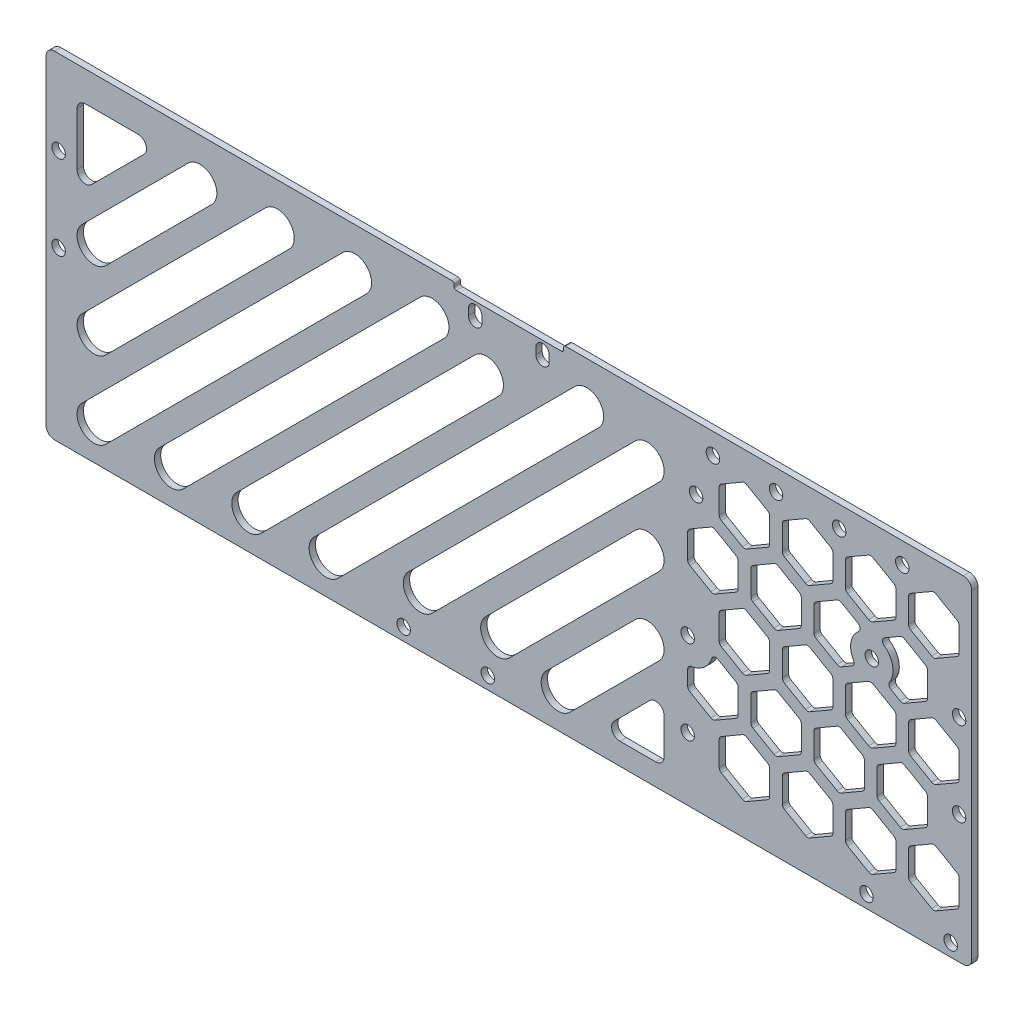
from build123d import *

# Parameters (mm, degrees)
SKETCH_1_W          = 220
SKETCH_1_H          = 80
EXTRUDE_1_DEPTH     = 1.5
SKETCH_2_R          = 1.6
CUT_EXTRUDE_1_DEPTH = 10
SKETCH_3_W          = 26
SKETCH_3_H          = 3
CUT_EXTRUDE_2_DEPTH = 11.5
FILLET_1_R          = 0.5
CUT_EXTRUDE_3_DEPTH = 2
FILLET_2_R          = 2
CUT_EXTRUDE_4_DEPTH = 10
OTHER_1_DEPTH       = 1.5
SKETCH_7_R          = 5.042374288
SKETCH_7_R_2        = 1.6
SKETCH_7_R_3        = 6.035452472
EXTRUDE_2_DEPTH     = 1.5
FILLET_4_R          = 1
SKETCH_8_R          = 1.6
CUT_EXTRUDE_5_DEPTH = 1.5
FILLET_5_R          = 2


# Read off the part's stored shape, not the designer's step: 填充阵列1
with BuildPart() as part:
    # 草图1 → 凸台-拉伸1 (new body)
    with BuildSketch(Plane.XY):
        Rectangle(SKETCH_1_W, SKETCH_1_H)
    extrude(amount=EXTRUDE_1_DEPTH)

    # 草图2 → 切除-拉伸1 (cut)
    with BuildSketch(Plane(origin=(0, 0, 0), x_dir=(-1, 0, 0), z_dir=(0, 0, -1))):
        with Locations((-105, -37)):
            Circle(SKETCH_2_R)
        with Locations((-85, -37)):
            Circle(SKETCH_2_R)
        with Locations((25, -37)):
            Circle(SKETCH_2_R)
        with Locations((5, -37)):
            Circle(SKETCH_2_R)
        with Locations((-42.5, -5)):
            Circle(SKETCH_2_R)
        with Locations((-42.5, -25)):
            Circle(SKETCH_2_R)
        with Locations((-86.258808939, 12.137759751)):
            Circle(SKETCH_2_R)
        with Locations((107, 20)):
            Circle(SKETCH_2_R)
        with Locations((107, 0)):
            Circle(SKETCH_2_R)
    extrude(amount=-CUT_EXTRUDE_1_DEPTH, mode=Mode.SUBTRACT)

    # 草图3 → 切除-拉伸2 (cut)
    with BuildSketch(Plane(origin=(0, 0, 0), x_dir=(-1, 0, 0), z_dir=(0, 0, -1))):
        with Locations((0, 40)):
            Rectangle(SKETCH_3_W, SKETCH_3_H)
        with BuildLine():
            Line((-6.4, 36.25), (-6.4, 34.75))
            ThreePointArc((-6.4, 34.75), (-8, 33.15), (-9.6, 34.75))
            Line((-9.6, 34.75), (-9.6, 36.25))
            ThreePointArc((-9.6, 36.25), (-8, 37.85), (-6.4, 36.25))
        make_face()
        with BuildLine():
            Line((6.4, 36.25), (6.4, 34.75))
            ThreePointArc((6.4, 34.75), (8, 33.15), (9.6, 34.75))
            Line((9.6, 34.75), (9.6, 36.25))
            ThreePointArc((9.6, 36.25), (8, 37.85), (6.4, 36.25))
        make_face()
    extrude(amount=-CUT_EXTRUDE_2_DEPTH, mode=Mode.SUBTRACT)

    # 圆角1
    fillet_1_edges = [part.edges().sort_by_distance(p)[0] for p in [
        (-13, 40, 0.75),
        (13, 40, 0.75),
        (13, 38.5, 0.75),
        (-13, 38.5, 0.75),
    ]]
    fillet(fillet_1_edges, radius=FILLET_1_R)

    # 草图5 → 切除-拉伸3 (cut)
    with BuildSketch(Plane(origin=(0, 0, 0), x_dir=(-1, 0, 0), z_dir=(0, 0, -1))):
        with BuildLine():
            Line((-30.071572875, -7.95836944), (-8.85836944, -29.171572875))
            ThreePointArc((-8.85836944, -29.171572875), (-8.85836944, -34.828427125), (-14.515223689, -34.828427125))
            Line((-14.515223689, -34.828427125), (-35.728427125, -13.615223689))
            ThreePointArc((-35.728427125, -13.615223689), (-35.728427125, -7.95836944), (-30.071572875, -7.95836944))
        make_face()
        with BuildLine():
            Line((-30.071572875, 10.426406871), (5.526406871, -25.171572875))
            ThreePointArc((5.526406871, -25.171572875), (5.526406871, -30.828427125), (-0.130447378, -30.828427125))
            Line((-0.130447378, -30.828427125), (-35.728427125, 4.769552622))
            ThreePointArc((-35.728427125, 4.769552622), (-35.728427125, 10.426406871), (-30.071572875, 10.426406871))
        make_face()
        with BuildLine():
            Line((-15.704040507, 32.828427125), (46.295959493, -29.171572875))
            ThreePointArc((46.295959493, -29.171572875), (46.295959493, -34.828427125), (40.639105243, -34.828427125))
            Line((40.639105243, -34.828427125), (-21.360894757, 27.171572875))
            ThreePointArc((-21.360894757, 27.171572875), (-21.360894757, 32.828427125), (-15.704040507, 32.828427125))
        make_face()
        with BuildLine():
            Line((8.112193309, 27.39696962), (64.680735804, -29.171572875))
            ThreePointArc((64.680735804, -29.171572875), (64.680735804, -34.828427125), (59.023881554, -34.828427125))
            Line((59.023881554, -34.828427125), (2.455339059, 21.74011537))
            ThreePointArc((2.455339059, 21.74011537), (2.455339059, 27.39696962), (8.112193309, 27.39696962))
        make_face()
        with BuildLine():
            Line((39.450288425, 32.828427125), (101.450288425, -29.171572875))
            ThreePointArc((101.450288425, -29.171572875), (101.450288425, -34.828427125), (95.793434176, -34.828427125))
            Line((95.793434176, -34.828427125), (33.793434176, 27.171572875))
            ThreePointArc((33.793434176, 27.171572875), (33.793434176, 32.828427125), (39.450288425, 32.828427125))
        make_face()
        with BuildLine():
            Line((76.219841047, 32.828427125), (101.450288425, 7.597979746))
            ThreePointArc((101.450288425, 7.597979746), (101.450288425, 1.941125497), (95.793434176, 1.941125497))
            Line((95.793434176, 1.941125497), (70.562986798, 27.171572875))
            ThreePointArc((70.562986798, 27.171572875), (70.562986798, 32.828427125), (76.219841047, 32.828427125))
        make_face()
        with BuildLine():
            Line((21.065512115, 32.828427125), (83.065512115, -29.171572875))
            ThreePointArc((83.065512115, -29.171572875), (83.065512115, -34.828427125), (77.408657865, -34.828427125))
            Line((77.408657865, -34.828427125), (15.408657865, 27.171572875))
            ThreePointArc((15.408657865, 27.171572875), (15.408657865, 32.828427125), (21.065512115, 32.828427125))
        make_face()
        with BuildLine():
            Line((-30.071572875, 28.811183182), (23.911183182, -25.171572875))
            ThreePointArc((23.911183182, -25.171572875), (23.911183182, -30.828427125), (18.254328933, -30.828427125))
            Line((18.254328933, -30.828427125), (-35.728427125, 23.154328933))
            ThreePointArc((-35.728427125, 23.154328933), (-35.728427125, 28.811183182), (-30.071572875, 28.811183182))
        make_face()
        with BuildLine():
            Line((57.835064736, 32.828427125), (101.450288425, -10.786796564))
            ThreePointArc((101.450288425, -10.786796564), (101.450288425, -16.443650814), (95.793434176, -16.443650814))
            Line((95.793434176, -16.443650814), (52.178210487, 27.171572875))
            ThreePointArc((52.178210487, 27.171572875), (52.178210487, 32.828427125), (57.835064736, 32.828427125))
        make_face()
        Polygon((83.290908859, 32.828427125), (102.621861301, 32.828427125), (102.621861301, 13.497474683), align=None)
        Polygon((-36.9, -19.514718626), (-36.9, -34.828427125), (-21.586291501, -34.828427125), align=None)
    extrude(amount=-CUT_EXTRUDE_3_DEPTH, mode=Mode.SUBTRACT)

    # 圆角2
    fillet_2_edges = [part.edges().sort_by_distance(p)[0] for p in [
        (-102.621861301, 13.497474683, 0.75),
        (-83.290908859, 32.828427125, 0.75),
        (-102.621861301, 32.828427125, 0.75),
        (36.9, -19.514718626, 0.75),
        (21.586291501, -34.828427125, 0.75),
        (36.9, -34.828427125, 0.75),
    ]]
    fillet(fillet_2_edges, radius=FILLET_2_R)

    # 草图6 → 切除-拉伸4 (cut)
    with BuildSketch(Plane(origin=(0, 0, 0), x_dir=(-1, 0, 0), z_dir=(0, 0, -1))):
        Polygon((-107, -22.107695155), (-107, -29.035898385), (-101, -32.5), (-95, -29.035898385), (-95, -22.107695155), (-101, -18.643593539), align=None)
    extrude(amount=-CUT_EXTRUDE_4_DEPTH, mode=Mode.SUBTRACT)

    # 填充阵列1 outline → 填充阵列1 (cut)
    with BuildSketch(Plane.XY):
        Polygon((101, 19.461524227), (107, 22.925625842), (107, 29.853829072), (101, 33.317930688), (95, 29.853829072), (95, 22.925625842), align=None)
        Polygon((101, -6.519237886), (107, -3.055136271), (107, 3.873066959), (101, 7.337168574), (95, 3.873066959), (95, -3.055136271), align=None)
        Polygon((62, -3.055136271), (62, 3.873066959), (56, 7.337168574), (50, 3.873066959), (50, -3.055136271), (56, -6.519237886), align=None)
        Polygon((84.5, -16.045517328), (84.5, -9.117314098), (78.5, -5.653212483), (72.5, -9.117314098), (72.5, -16.045517328), (78.5, -19.509618943), align=None)
        with BuildLine():
            Line((93.5, 20.327549631), (87.5, 16.863448016))
            Line((87.5, 16.863448016), (87.5, 13.147435318))
            ThreePointArc((87.5, 13.147435318), (87.858808939, 12.137759751), (87.499999999, 11.128084183))
            Line((87.499999999, 11.128084183), (87.5, 9.935244785))
            Line((87.5, 9.935244785), (93.5, 6.47114317))
            Line((93.5, 6.47114317), (99.5, 9.935244785))
            Line((99.5, 9.935244785), (99.5, 16.863448016))
            Line((99.5, 16.863448016), (93.5, 20.327549631))
        make_face()
        Polygon((93.5, -5.653212483), (87.5, -9.117314098), (87.5, -16.045517328), (93.5, -19.509618943), (99.5, -16.045517328), (99.5, -9.117314098), align=None)
        Polygon((77, 22.925625842), (77, 29.853829072), (71, 33.317930688), (65, 29.853829072), (65, 22.925625842), (71, 19.461524227), align=None)
        Polygon((54.5, -9.117314098), (48.5, -5.653212483), (42.5, -9.117314098), (42.5, -16.045517328), (48.5, -19.509618943), (54.5, -16.045517328), align=None)
        Polygon((77, 3.873066959), (71, 7.337168574), (65, 3.873066959), (65, -3.055136271), (71, -6.519237886), (77, -3.055136271), align=None)
        Polygon((48.5, 6.47114317), (54.5, 9.935244785), (54.5, 16.863448016), (48.5, 20.327549631), (42.5, 16.863448016), (42.5, 9.935244785), align=None)
        Polygon((77, -29.035898385), (77, -22.107695155), (71, -18.643593539), (65, -22.107695155), (65, -29.035898385), (71, -32.5), align=None)
        Polygon((84.5, 16.863448016), (78.5, 20.327549631), (72.5, 16.863448016), (72.5, 9.935244785), (78.5, 6.47114317), (84.5, 9.935244785), align=None)
        Polygon((62, 22.925625842), (62, 29.853829072), (56, 33.317930688), (50, 29.853829072), (50, 22.925625842), (56, 19.461524227), align=None)
        Polygon((62, -22.107695155), (56, -18.643593539), (50, -22.107695155), (50, -29.035898385), (56, -32.5), (62, -29.035898385), align=None)
        Polygon((63.5, 6.47114317), (69.5, 9.935244785), (69.5, 16.863448016), (63.5, 20.327549631), (57.5, 16.863448016), (57.5, 9.935244785), align=None)
        Polygon((63.5, -19.509618943), (69.5, -16.045517328), (69.5, -9.117314098), (63.5, -5.653212483), (57.5, -9.117314098), (57.5, -16.045517328), align=None)
        Polygon((92, -3.055136271), (92, 3.873066959), (86, 7.337168574), (80, 3.873066959), (80, -3.055136271), (86, -6.519237886), align=None)
        Polygon((92, 29.853829072), (86, 33.317930688), (80, 29.853829072), (80, 22.925625842), (86, 19.461524227), (92, 22.925625842), align=None)
        Polygon((92, -29.035898385), (92, -22.107695155), (86, -18.643593539), (80, -22.107695155), (80, -29.035898385), (86, -32.5), align=None)
    extrude(amount=OTHER_1_DEPTH, mode=Mode.SUBTRACT)

    # 草图7 → 凸台-拉伸2 (add)
    # profile 1 of 2: a face of its own
    with BuildSketch(Plane(origin=(0, 0, 0), x_dir=(-1, 0, 0), z_dir=(0, 0, -1))):
        with Locations((-86.258808939, 12.137759751)):
            Circle(SKETCH_7_R)
        with Locations((-86.258808939, 12.137759751)):
            Circle(SKETCH_7_R_2, mode=Mode.SUBTRACT)
    # profile 2 of 2: a face of its own
    with BuildSketch(Plane(origin=(0, 0, 0), x_dir=(-1, 0, 0), z_dir=(0, 0, -1))):
        with Locations((-42.5, -5)):
            Circle(SKETCH_7_R_3)
        with Locations((-42.5, -5)):
            Circle(SKETCH_7_R_2, mode=Mode.SUBTRACT)
    extrude(amount=-EXTRUDE_2_DEPTH)

    # 圆角4
    fillet_4_edges = [part.edges().sort_by_distance(p)[0] for p in [
        (82.497718932, 8.779227271, 0.75),
        (87.689560022, 16.972890546, 0.75),
        (89.837615356, 8.58562193, 0.75),
        (86.414610565, 7.097793053, 0.75),
        (85.645964708, 7.132766203, 0.75),
        (42.5, -11.035452472, 0.75),
        (107, -29.035898385, 0.75),
        (107, -22.107695155, 0.75),
        (101, -18.643593539, 0.75),
        (95, -22.107695155, 0.75),
        (95, -29.035898385, 0.75),
        (101, -32.5, 0.75),
        (92, -29.035898385, 0.75),
        (92, -22.107695155, 0.75),
        (86, -18.643593539, 0.75),
        (80, -22.107695155, 0.75),
        (80, -29.035898385, 0.75),
        (86, -32.5, 0.75),
        (84.5, -16.045517328, 0.75),
        (84.5, -9.117314098, 0.75),
        (78.5, -5.653212483, 0.75),
        (72.5, -9.117314098, 0.75),
        (72.5, -16.045517328, 0.75),
        (78.5, -19.509618943, 0.75),
        (84.5, 16.863448016, 0.75),
        (78.5, 20.327549631, 0.75),
        (72.5, 16.863448016, 0.75),
        (72.5, 9.935244785, 0.75),
        (78.5, 6.47114317, 0.75),
        (77, 22.925625842, 0.75),
        (77, 29.853829072, 0.75),
        (71, 33.317930688, 0.75),
        (65, 29.853829072, 0.75),
        (65, 22.925625842, 0.75),
        (71, 19.461524227, 0.75),
        (92, 22.925625842, 0.75),
        (92, 29.853829072, 0.75),
        (86, 33.317930688, 0.75),
        (80, 29.853829072, 0.75),
        (80, 22.925625842, 0.75),
        (86, 19.461524227, 0.75),
        (99.5, 9.935244785, 0.75),
        (99.5, 16.863448016, 0.75),
        (93.5, 20.327549631, 0.75),
        (93.5, 6.47114317, 0.75),
        (92, -3.055136271, 0.75),
        (92, 3.873066959, 0.75),
        (80, 3.873066959, 0.75),
        (80, -3.055136271, 0.75),
        (86, -6.519237886, 0.75),
        (99.5, -16.045517328, 0.75),
        (99.5, -9.117314098, 0.75),
        (93.5, -5.653212483, 0.75),
        (87.5, -9.117314098, 0.75),
        (87.5, -16.045517328, 0.75),
        (93.5, -19.509618943, 0.75),
        (62, -3.055136271, 0.75),
        (62, 3.873066959, 0.75),
        (56, 7.337168574, 0.75),
        (50, 3.873066959, 0.75),
        (50, -3.055136271, 0.75),
        (56, -6.519237886, 0.75),
        (69.5, -16.045517328, 0.75),
        (69.5, -9.117314098, 0.75),
        (63.5, -5.653212483, 0.75),
        (57.5, -9.117314098, 0.75),
        (57.5, -16.045517328, 0.75),
        (63.5, -19.509618943, 0.75),
        (54.5, 9.935244785, 0.75),
        (54.5, 16.863448016, 0.75),
        (48.5, 20.327549631, 0.75),
        (42.5, 16.863448016, 0.75),
        (42.5, 9.935244785, 0.75),
        (48.5, 6.47114317, 0.75),
        (62, -29.035898385, 0.75),
        (62, -22.107695155, 0.75),
        (56, -18.643593539, 0.75),
        (50, -22.107695155, 0.75),
        (50, -29.035898385, 0.75),
        (56, -32.5, 0.75),
        (69.5, 9.935244785, 0.75),
        (69.5, 16.863448016, 0.75),
        (63.5, 20.327549631, 0.75),
        (57.5, 16.863448016, 0.75),
        (57.5, 9.935244785, 0.75),
        (63.5, 6.47114317, 0.75),
        (77, -3.055136271, 0.75),
        (77, 3.873066959, 0.75),
        (71, 7.337168574, 0.75),
        (65, 3.873066959, 0.75),
        (65, -3.055136271, 0.75),
        (71, -6.519237886, 0.75),
        (62, 22.925625842, 0.75),
        (62, 29.853829072, 0.75),
        (56, 33.317930688, 0.75),
        (50, 29.853829072, 0.75),
        (50, 22.925625842, 0.75),
        (56, 19.461524227, 0.75),
        (77, -29.035898385, 0.75),
        (77, -22.107695155, 0.75),
        (71, -18.643593539, 0.75),
        (65, -22.107695155, 0.75),
        (65, -29.035898385, 0.75),
        (71, -32.5, 0.75),
        (107, -3.055136271, 0.75),
        (107, 3.873066959, 0.75),
        (101, 7.337168574, 0.75),
        (95, 3.873066959, 0.75),
        (95, -3.055136271, 0.75),
        (101, -6.519237886, 0.75),
        (107, 22.925625842, 0.75),
        (107, 29.853829072, 0.75),
        (101, 33.317930688, 0.75),
        (95, 29.853829072, 0.75),
        (95, 22.925625842, 0.75),
        (101, 19.461524227, 0.75),
        (54.5, -16.045517328, 0.75),
        (54.5, -9.117314098, 0.75),
        (48.5, -5.653212483, 0.75),
        (42.5, -16.045517328, 0.75),
        (48.5, -19.509618943, 0.75),
    ]]
    fillet(fillet_4_edges, radius=FILLET_4_R)

    # 草图8 → 切除-拉伸5 (cut)
    with BuildSketch(Plane(origin=(0, 0, 0), x_dir=(-1, 0, 0), z_dir=(0, 0, -1))):
        with Locations((-107, -9.591034656)):
            Circle(SKETCH_8_R)
        with Locations((-107, 10.408965344)):
            Circle(SKETCH_8_R)
        with Locations((-93.5, 35)):
            Circle(SKETCH_8_R)
        with Locations((-78.5, 35)):
            Circle(SKETCH_8_R)
        with Locations((-63.5, 35)):
            Circle(SKETCH_8_R)
        with Locations((-48.5, 35)):
            Circle(SKETCH_8_R)
        with Locations((-44.5, 25)):
            Circle(SKETCH_8_R)
    extrude(amount=-CUT_EXTRUDE_5_DEPTH, mode=Mode.SUBTRACT)

    # 圆角5
    fillet_5_edges = [part.edges().sort_by_distance(p)[0] for p in [
        (110, -40, 0.75),
        (-110, -40, 0.75),
        (-110, 40, 0.75),
        (110, 40, 0.75),
    ]]
    fillet(fillet_5_edges, radius=FILLET_5_R)


solid = part.part
